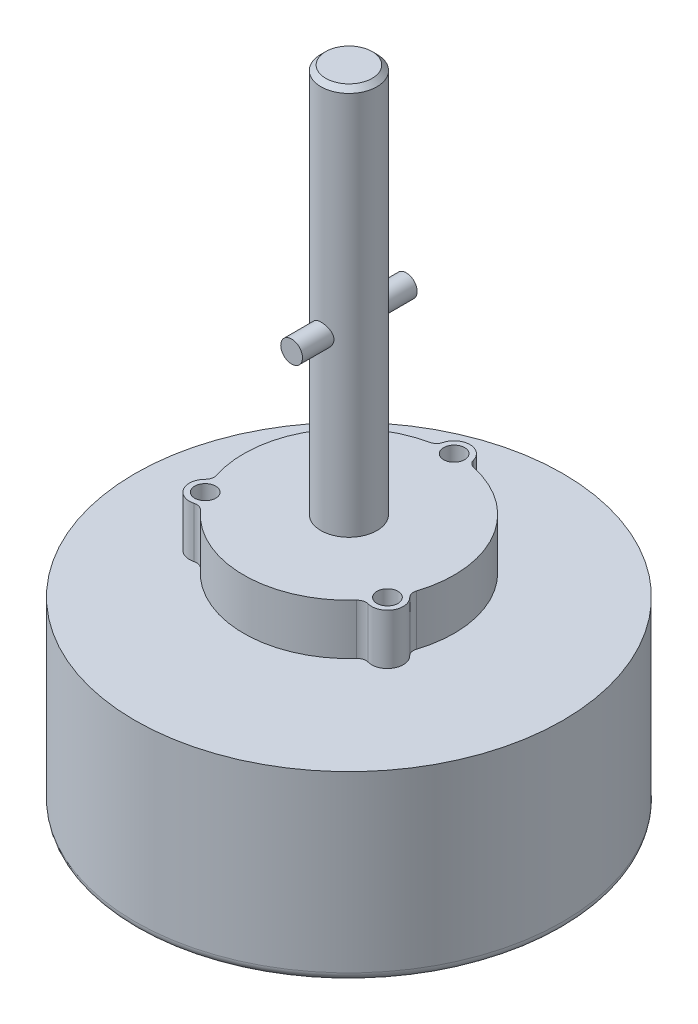
from build123d import *

# Parameters (mm, degrees)
SKETCH1_R           = 30.5
BOSS_EXTRUDE1_DEPTH = 26.1
SKETCH2_R           = 10.25
BOSS_EXTRUDE2_DEPTH = 3
SKETCH3_R           = 17.25
BOSS_EXTRUDE3_DEPTH = 7.2
CUT_EXTRUDE1_START  = -10.2
CUT_EXTRUDE1_DEPTH  = 10.2
SKETCH4_4_R         = 1.5
CUT_EXTRUDE2_DEPTH  = 7.2
SKETCH7_R           = 4
BOSS_EXTRUDE4_DEPTH = 55.5
FILLET1_R           = 1.25
SKETCH8_R           = 1.55
BOSS_EXTRUDE5_DEPTH = 8.175


# Read off the part's stored shape, not the designer's step: M8x1.25 Machine Threads Stud1
with BuildPart() as part:
    # Sketch1 → Boss-Extrude1 (new body)
    with BuildSketch(Plane(origin=(0, 0, 0), x_dir=(1, 0, 0), z_dir=(0, 1, 0))):
        with Locations(Location((0, 0, 0), (0, 0, 270))):
            Circle(SKETCH1_R)
    extrude(amount=BOSS_EXTRUDE1_DEPTH)

    # Sketch2 → Boss-Extrude2 (add)
    with BuildSketch(Plane(origin=(0, 26.1, 0), x_dir=(1, 0, 0), z_dir=(0, 1, 0))):
        with Locations(Location((0, 0, 0), (0, 0, 270))):
            Circle(SKETCH2_R)
    extrude(amount=BOSS_EXTRUDE2_DEPTH)

    # Sketch3 → Boss-Extrude3 (add)
    with BuildSketch(Plane(origin=(0, 29.1, 0), x_dir=(1, 0, 0), z_dir=(0, 1, 0))):
        with Locations(Location((0, 0, 0), (0, 0, 270))):
            Circle(SKETCH3_R)
    extrude(amount=BOSS_EXTRUDE3_DEPTH)

    # Sketch4 → Cut-Extrude1 (cut)
    with BuildSketch(Plane(origin=(0, 36.3, 0), x_dir=(1, 0, 0), z_dir=(0, 1, 0)).offset(CUT_EXTRUDE1_START)):
        with BuildLine():
            ThreePointArc((-13.966070745, -5.472555887), (-12.990381057, 7.5), (-2.243662951, 14.83125))
            ThreePointArc((-2.243662951, 14.83125), (-1.649573809, 16.530165432), (0, 17.25))
            ThreePointArc((0, 17.25), (-14.938938189, 8.625000045), (-14.938938267, -8.62499991))
            ThreePointArc((-14.938938267, -8.62499991), (-15.140330082, -6.836509843), (-13.966070745, -5.472555887))
        make_face()
        with BuildLine():
            ThreePointArc((2.243662951, 14.83125), (12.990381057, 7.5), (13.966070745, -5.472555887))
            ThreePointArc((13.966070745, -5.472555887), (15.140330099, -6.836509898), (14.938938209, -8.62500001))
            ThreePointArc((14.938938209, -8.62500001), (14.938938218, 8.624999995), (0, 17.25))
            ThreePointArc((0, 17.25), (1.649573809, 16.530165432), (2.243662951, 14.83125))
        make_face()
        with BuildLine():
            ThreePointArc((11.722407794, -9.358694113), (0, -15), (-11.722407794, -9.358694113))
            ThreePointArc((-11.722407794, -9.358694113), (-13.49075634, -9.693655528), (-14.938938267, -8.62499991))
            ThreePointArc((-14.938938267, -8.62499991), (-5.8e-08, -17.25), (14.938938209, -8.62500001))
            ThreePointArc((14.938938209, -8.62500001), (13.490756283, -9.693655541), (11.722407794, -9.358694113))
        make_face()
    extrude(amount=CUT_EXTRUDE1_DEPTH, mode=Mode.SUBTRACT)

    # Sketch4<4> → Cut-Extrude2 (cut)
    with BuildSketch(Plane(origin=(0, 36.3, 0), x_dir=(1, 0, 0), z_dir=(0, 1, 0))):
        with Locations(Location((0, 15, 0), (0, 0, 270))):
            Circle(SKETCH4_4_R)
        with Locations(Location((12.990381057, -7.5, 0), (0, 0, 270))):
            Circle(SKETCH4_4_R)
        with Locations(Location((-12.990381057, -7.5, 0), (0, 0, 270))):
            Circle(SKETCH4_4_R)
    extrude(amount=-CUT_EXTRUDE2_DEPTH, mode=Mode.SUBTRACT)

    # Sketch7 → Boss-Extrude4 (add)
    with BuildSketch(Plane(origin=(0, 36.3, 0), x_dir=(1, 0, 0), z_dir=(0, 1, 0))):
        with Locations(Location((0, 0, 0), (0, 0, 270))):
            Circle(SKETCH7_R)
    extrude(amount=BOSS_EXTRUDE4_DEPTH)

    # Fillet1
    fillet1_edges = [part.edges().sort_by_distance(p)[0] for p in [
        (0, 0, -30.5),
        (-13.966070745, 32.7, 5.472555887),
        (-2.243662951, 32.7, -14.83125),
        (13.966070745, 32.7, 5.472555887),
        (2.243662951, 32.7, -14.83125),
        (-11.722407794, 32.7, 9.358694113),
        (11.722407794, 32.7, 9.358694113),
    ]]
    fillet(fillet1_edges, radius=FILLET1_R)

    # Sketch8 → Boss-Extrude5 (add, symmetric)
    with BuildSketch(Plane.XY):
        with Locations(Location((0, 60.5, 0), (0, 0, 180))):
            Circle(SKETCH8_R)
    extrude(amount=BOSS_EXTRUDE5_DEPTH, both=True)

    # M8x1.25 Machine Threads Stud1 outline → M8x1.25 Machine Threads Stud1 (revolve, cut)
    with BuildSketch(Plane.XY):
        Polygon((4, 91.8), (3.3095, 91.8), (4, 91.1095), align=None)
    revolve(axis=Axis((0, 0, 0), (0, 1, 0)), mode=Mode.SUBTRACT)


solid = part.part
